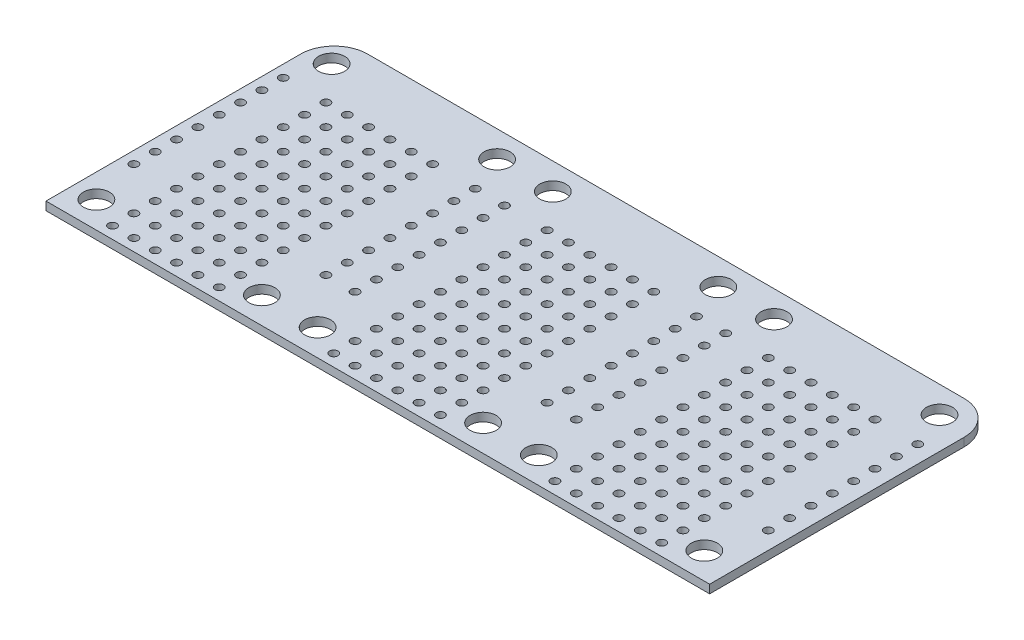
from build123d import *

# Parameters (mm, degrees)
BOARD_W             = 79
BOARD_H             = 34.3
BOSS_EXTRUDE1_DEPTH = 1
HOLES_R             = 1.55
HOLES_R_2           = 0.5
CUT_EXTRUDE1_DEPTH  = 87.130656563
LPATTERN1_COUNT     = 3
LPATTERN1_PITCH     = 26.333333333
FILLET1_R           = 4


with BuildPart() as part:
    # board → Boss-Extrude1 (new body)
    with BuildSketch(Plane(origin=(0, 0, 0), x_dir=(1, 0, 0), z_dir=(0, 1, 0))):
        with Locations((39.5, 17.15)):
            Rectangle(BOARD_W, BOARD_H)
    extrude(amount=BOSS_EXTRUDE1_DEPTH)

    # holes → Cut-Extrude1 (cut, through all)
    with BuildSketch(Plane(origin=(0, 0, 0), x_dir=(1, 0, 0), z_dir=(0, 1, 0))):
        with Locations((2.85, 31.15)):
            Circle(HOLES_R)
        with Locations((22.55, 31.15)):
            Circle(HOLES_R)
        with Locations((22.55, 3.15)):
            Circle(HOLES_R)
        with Locations((2.85, 3.15)):
            Circle(HOLES_R)
        with Locations((1.42, 26.82)):
            Circle(HOLES_R_2)
        with Locations((24.28, 26.82)):
            Circle(HOLES_R_2)
        with Locations((6.5, 26.82)):
            Circle(HOLES_R_2)
        with Locations((1.42, 24.28)):
            Circle(HOLES_R_2)
        with Locations((24.28, 24.28)):
            Circle(HOLES_R_2)
        with Locations((1.42, 21.74)):
            Circle(HOLES_R_2)
        with Locations((24.28, 21.74)):
            Circle(HOLES_R_2)
        with Locations((1.42, 19.2)):
            Circle(HOLES_R_2)
        with Locations((24.28, 19.2)):
            Circle(HOLES_R_2)
        with Locations((1.42, 16.66)):
            Circle(HOLES_R_2)
        with Locations((24.28, 16.66)):
            Circle(HOLES_R_2)
        with Locations((1.42, 14.12)):
            Circle(HOLES_R_2)
        with Locations((24.28, 14.12)):
            Circle(HOLES_R_2)
        with Locations((1.42, 11.58)):
            Circle(HOLES_R_2)
        with Locations((24.28, 11.58)):
            Circle(HOLES_R_2)
        with Locations((1.42, 9.04)):
            Circle(HOLES_R_2)
        with Locations((24.28, 9.04)):
            Circle(HOLES_R_2)
        with Locations((6.5, 24.28)):
            Circle(HOLES_R_2)
        with Locations((6.5, 21.74)):
            Circle(HOLES_R_2)
        with Locations((6.5, 19.2)):
            Circle(HOLES_R_2)
        with Locations((6.5, 16.66)):
            Circle(HOLES_R_2)
        with Locations((6.5, 14.12)):
            Circle(HOLES_R_2)
        with Locations((6.5, 11.58)):
            Circle(HOLES_R_2)
        with Locations((6.5, 9.04)):
            Circle(HOLES_R_2)
        with Locations((6.5, 6.5)):
            Circle(HOLES_R_2)
        with Locations((6.5, 3.96)):
            Circle(HOLES_R_2)
        with Locations((6.5, 1.42)):
            Circle(HOLES_R_2)
        with Locations((9.04, 24.28)):
            Circle(HOLES_R_2)
        with Locations((9.04, 21.74)):
            Circle(HOLES_R_2)
        with Locations((9.04, 19.2)):
            Circle(HOLES_R_2)
        with Locations((9.04, 16.66)):
            Circle(HOLES_R_2)
        with Locations((9.04, 14.12)):
            Circle(HOLES_R_2)
        with Locations((9.04, 11.58)):
            Circle(HOLES_R_2)
        with Locations((9.04, 9.04)):
            Circle(HOLES_R_2)
        with Locations((9.04, 6.5)):
            Circle(HOLES_R_2)
        with Locations((9.04, 3.96)):
            Circle(HOLES_R_2)
        with Locations((9.04, 1.42)):
            Circle(HOLES_R_2)
        with Locations((11.58, 24.28)):
            Circle(HOLES_R_2)
        with Locations((11.58, 21.74)):
            Circle(HOLES_R_2)
        with Locations((11.58, 19.2)):
            Circle(HOLES_R_2)
        with Locations((11.58, 16.66)):
            Circle(HOLES_R_2)
        with Locations((11.58, 14.12)):
            Circle(HOLES_R_2)
        with Locations((11.58, 11.58)):
            Circle(HOLES_R_2)
        with Locations((11.58, 9.04)):
            Circle(HOLES_R_2)
        with Locations((11.58, 6.5)):
            Circle(HOLES_R_2)
        with Locations((11.58, 3.96)):
            Circle(HOLES_R_2)
        with Locations((11.58, 1.42)):
            Circle(HOLES_R_2)
        with Locations((14.12, 24.28)):
            Circle(HOLES_R_2)
        with Locations((14.12, 21.74)):
            Circle(HOLES_R_2)
        with Locations((14.12, 19.2)):
            Circle(HOLES_R_2)
        with Locations((14.12, 16.66)):
            Circle(HOLES_R_2)
        with Locations((14.12, 14.12)):
            Circle(HOLES_R_2)
        with Locations((14.12, 11.58)):
            Circle(HOLES_R_2)
        with Locations((14.12, 9.04)):
            Circle(HOLES_R_2)
        with Locations((14.12, 6.5)):
            Circle(HOLES_R_2)
        with Locations((14.12, 3.96)):
            Circle(HOLES_R_2)
        with Locations((14.12, 1.42)):
            Circle(HOLES_R_2)
        with Locations((16.66, 24.28)):
            Circle(HOLES_R_2)
        with Locations((16.66, 21.74)):
            Circle(HOLES_R_2)
        with Locations((16.66, 19.2)):
            Circle(HOLES_R_2)
        with Locations((16.66, 16.66)):
            Circle(HOLES_R_2)
        with Locations((16.66, 14.12)):
            Circle(HOLES_R_2)
        with Locations((16.66, 11.58)):
            Circle(HOLES_R_2)
        with Locations((16.66, 9.04)):
            Circle(HOLES_R_2)
        with Locations((16.66, 6.5)):
            Circle(HOLES_R_2)
        with Locations((16.66, 3.96)):
            Circle(HOLES_R_2)
        with Locations((16.66, 1.42)):
            Circle(HOLES_R_2)
        with Locations((19.2, 24.28)):
            Circle(HOLES_R_2)
        with Locations((19.2, 21.74)):
            Circle(HOLES_R_2)
        with Locations((19.2, 19.2)):
            Circle(HOLES_R_2)
        with Locations((19.2, 16.66)):
            Circle(HOLES_R_2)
        with Locations((19.2, 14.12)):
            Circle(HOLES_R_2)
        with Locations((19.2, 11.58)):
            Circle(HOLES_R_2)
        with Locations((19.2, 9.04)):
            Circle(HOLES_R_2)
        with Locations((19.2, 6.5)):
            Circle(HOLES_R_2)
        with Locations((19.2, 3.96)):
            Circle(HOLES_R_2)
        with Locations((19.2, 1.42)):
            Circle(HOLES_R_2)
        with Locations((9.04, 26.82)):
            Circle(HOLES_R_2)
        with Locations((11.58, 26.82)):
            Circle(HOLES_R_2)
        with Locations((14.12, 26.82)):
            Circle(HOLES_R_2)
        with Locations((16.66, 26.82)):
            Circle(HOLES_R_2)
        with Locations((19.2, 26.82)):
            Circle(HOLES_R_2)
    cut_extrude1 = extrude(amount=CUT_EXTRUDE1_DEPTH, mode=Mode.SUBTRACT)

    # LPattern1: Cut-Extrude1 ×3
    with Locations(*[(i * LPATTERN1_PITCH, 0, 0) for i in range(1, LPATTERN1_COUNT)]):
        add(cut_extrude1, mode=Mode.SUBTRACT)

    # Fillet1
    fillet1_edges = [part.edges().sort_by_distance(p)[0] for p in [
        (79, 0.5, -34.3),
        (0, 0.5, -34.3),
    ]]
    fillet(fillet1_edges, radius=FILLET1_R)


solid = part.part
